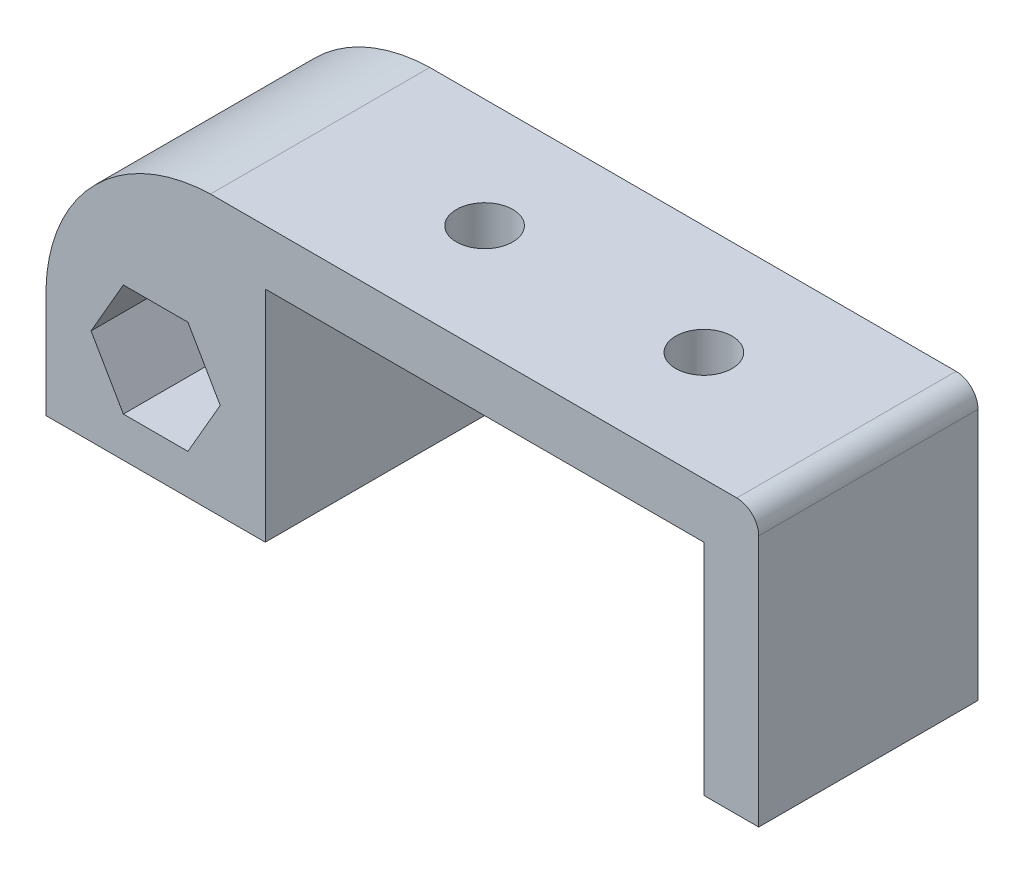
from build123d import *

# Parameters (mm, degrees)
BOSS_EXTRUDE2_DEPTH = 25.4
SKETCH2_R           = 3.2639
CUT_EXTRUDE1_DEPTH  = 71.138042459


with BuildPart() as part:
    # Sketch1 → Boss-Extrude2 (new body)
    with BuildSketch(Plane.XY):
        with BuildLine():
            Line((50.8, 0), (57.15, 0))
            Line((57.15, 0), (57.15, 29.21))
            ThreePointArc((57.15, 29.21), (56.406051224, 31.006051224), (54.61, 31.75))
            Line((54.61, 31.75), (-6.35, 31.75))
            ThreePointArc((-6.35, 31.75), (-19.678174928, 26.028174928), (-25.4, 12.7))
            Line((-25.4, 12.7), (-25.4, 0))
            Line((-25.4, 0), (0, 0))
            Line((0, 0), (0, 25.4))
            Line((0, 25.4), (50.8, 25.4))
            Line((50.8, 25.4), (50.8, 0))
        make_face()
        Polygon((-8.960502306, 4.6355), (-5.221004613, 11.1125), (-8.960502306, 17.5895), (-16.439497694, 17.5895), (-20.178995387, 11.1125), (-16.439497694, 4.6355), align=None, mode=Mode.SUBTRACT)
    extrude(amount=BOSS_EXTRUDE2_DEPTH)

    # Sketch2 → Cut-Extrude1 (cut, through all)
    with BuildSketch(Plane(origin=(0, 31.75, 0), x_dir=(1, 0, 0), z_dir=(0, 1, 0))):
        with Locations((12.7, -12.7)):
            Circle(SKETCH2_R)
        with Locations((38.1, -12.7)):
            Circle(SKETCH2_R)
    extrude(amount=-CUT_EXTRUDE1_DEPTH, mode=Mode.SUBTRACT)


solid = part.part
